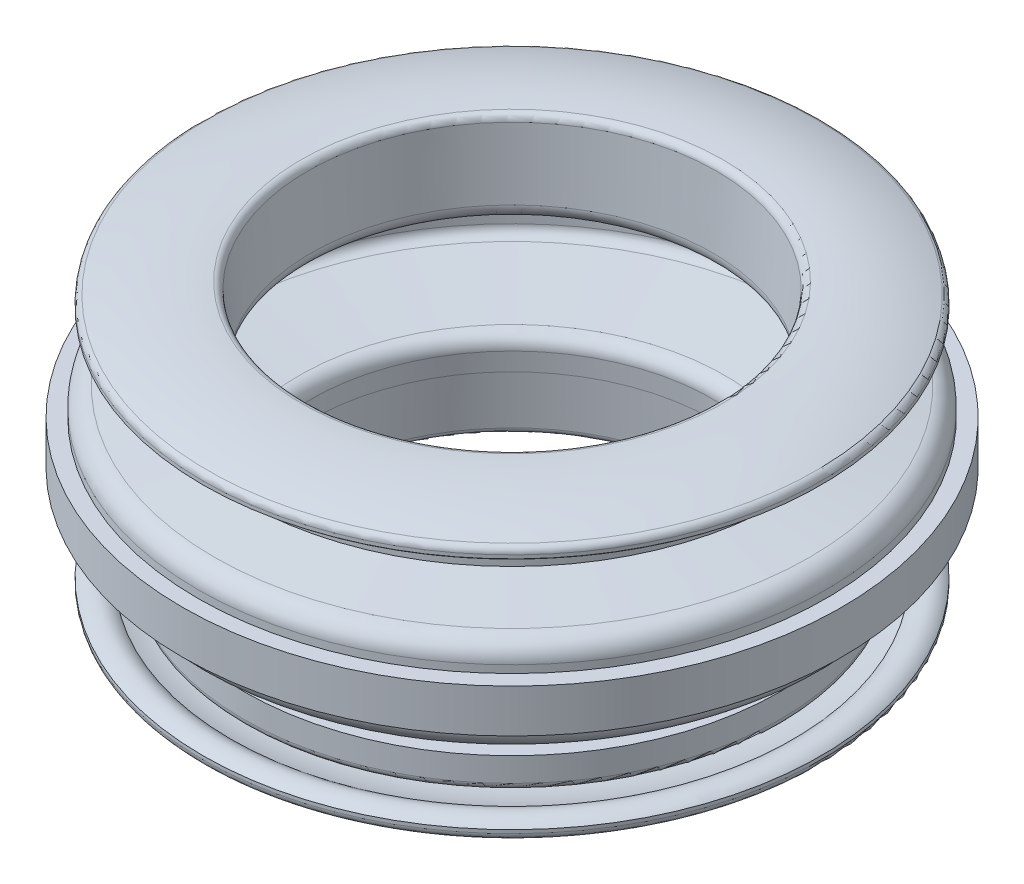
from build123d import *
from build123d.topology import SkipClean

# Parameters (mm, degrees)
DRAFT1_ANGLE = 3
FILLET3_R    = 1.27
FILLET4_R    = 1.27
FILLET5_R    = 1.27


with BuildPart() as part:
    # Sketch1 → Revolve1 (revolve)
    with BuildSketch(Plane.XY):
        with BuildLine():
            Line((36.83, 0), (36.83, -10.16))
            Line((36.83, -10.16), (48.26, -10.16))
            Line((48.26, -10.16), (48.26, -4.572))
            Line((48.26, -4.572), (43.045922533, -4.572))
            ThreePointArc((43.045922533, -4.572), (40.386, -3.556), (43.045922533, -2.54))
            ThreePointArc((43.045922533, -2.54), (46.818043436, -2.859781813), (50.4825, -3.81))
            ThreePointArc((50.4825, -3.81), (53.0225, -4.780193669), (55.5625, -3.81))
            Line((55.5625, -3.81), (55.5625, -2.286))
            ThreePointArc((55.5625, -2.286), (46.326524815, -0.075470262), (36.83, 0))
        make_face()
    revolve(axis=Axis((0, 0, 0), (0, 1, 0)))

    # Draft1
    draft1_faces = [part.faces().sort_by_distance(p)[0] for p in [
        (-36.83, -5.08, 0),
    ]]
    draft(draft1_faces, Plane.ZX, DRAFT1_ANGLE)

    # Fillet3
    fillet3_edges = [part.edges().sort_by_distance(p)[0] for p in [
        (-36.83, 0, 0),
    ]]
    fillet(fillet3_edges, radius=FILLET3_R)

    # Fillet4
    fillet4_edges = [part.edges().sort_by_distance(p)[0] for p in [
        (-55.5625, -2.286, 0),
    ]]
    fillet(fillet4_edges, radius=FILLET4_R)

    # Fillet5
    fillet5_edges = [part.edges().sort_by_distance(p)[0] for p in [
        (-48.26, -4.572, 0),
    ]]
    fillet(fillet5_edges, radius=FILLET5_R)


with BuildPart() as body_2:
    # Mirror4: mirrored copy
    add(part.part.mirror(Plane.ZX.offset(-24.892)))


with BuildPart() as part_1:
    with SkipClean():  # the faces are left unmerged after this step: merging them gives an invalid solid
        add(part.part)

        # Sketch2 → Revolve2 (revolve)
        with BuildSketch(Plane.XY):
            with BuildLine():
                Line((-59.260429256, -24.892), (-54.517557914, -24.892))
                Line((-54.517557914, -24.892), (-54.517557914, -21.005193817))
                Line((-54.517557914, -21.005193817), (-54.517557914, -20.332646756))
                ThreePointArc((-54.517557914, -20.332646756), (-54.102064725, -19.200355491), (-53.052815114, -18.605550185))
                Line((-53.052815114, -18.605550185), (-38.243445457, -16.154473362))
                ThreePointArc((-38.243445457, -16.154473362), (-36.67870771, -15.240176366), (-36.121675824, -13.515630429))
                Line((-36.121675824, -13.515630429), (-36.297536962, -10.16))
                Line((-36.297536962, -10.16), (-38.837536962, -10.16))
                Line((-38.837536962, -10.16), (-38.837536962, -12.062624512))
                ThreePointArc((-38.837536962, -12.062624512), (-39.289678025, -13.294787613), (-40.431474924, -13.942056716))
                Line((-40.431474924, -13.942056716), (-53.499191571, -16.10487513))
                ThreePointArc((-53.499191571, -16.10487513), (-55.645106368, -17.321364985), (-56.494868876, -19.637115741))
                Line((-56.494868876, -19.637115741), (-56.494868876, -21.005193817))
                Line((-56.494868876, -21.005193817), (-59.260429256, -21.005193817))
                Line((-59.260429256, -21.005193817), (-59.260429256, -24.892))
            make_face()
        revolve2 = revolve(axis=Axis((0, 0, 0), (0, -1, 0)))

    # Mirror5: Revolve2 across plane
    with SkipClean():  # the faces are left unmerged after this step: merging them gives an invalid solid
        add(revolve2.mirror(Plane.ZX.offset(-24.892)))


solid = Compound([body_2.part, part_1.part])
